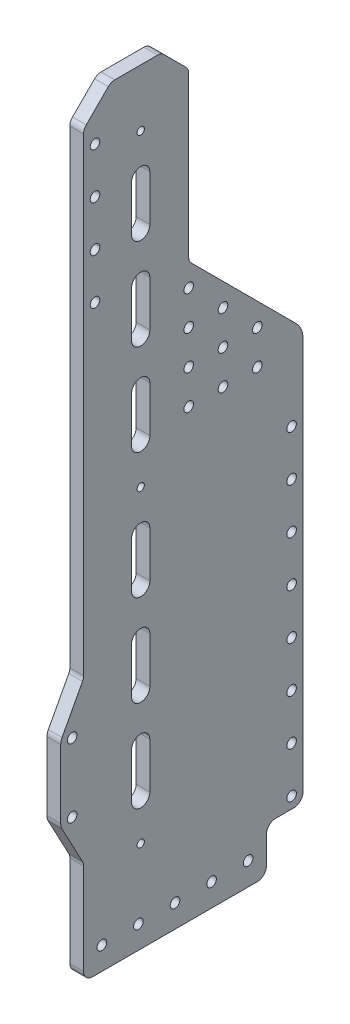
from build123d import *

# Parameters (mm, degrees)
SKETCH_1_W          = 80
SKETCH_1_H          = 315
SKETCH_1_R          = 1.6
SKETCH_1_H_2        = 20
SKETCH_1_R_2        = 2.1
EXTRUDE_1_DEPTH     = 6
SKETCH_2_W          = 16
SKETCH_2_H          = 180
EXTRUDE_2_DEPTH     = 6
SKETCH_3_W          = 34
SKETCH_3_H          = 85
CUT_EXTRUDE_1_DEPTH = 337.756588651
CHAMFER_1_SIZE      = 16
CHAMFER_2_SIZE      = 34
SKETCH_5_R          = 2.1
CUT_EXTRUDE_2_DEPTH = 337.756588651
SKETCH_5_3_R        = 2.1
EXTRUDE_3_DEPTH     = 6
SKETCH_6_R          = 2.1
CUT_EXTRUDE_3_DEPTH = 337.756588651
FILLET_START        = -1
FILLET_1_DEPTH      = 8
CHAMFER_3_SIZE      = 12
FILLET_2_DEPTH      = 8
FILLET_2_2_DEPTH    = 6
SKETCH_7_R          = 2.1
CUT_EXTRUDE_4_DEPTH = 337.756588651
CUT_EXTRUDE_5_DEPTH = 337.756588651


with BuildPart() as part:
    # 草图1 → 凸台-拉伸1 (new body)
    # profile 1 of 2: a face of its own
    with BuildSketch(Plane(origin=(0, 0, 0), x_dir=(0, 0, -1), z_dir=(1, 0, 0))):
        with Locations((32, 167.5)):
            Rectangle(SKETCH_1_W, SKETCH_1_H)
        with Locations((17, 300)):
            Circle(SKETCH_1_R, mode=Mode.SUBTRACT)
        with Locations((17, 165)):
            Circle(SKETCH_1_R, mode=Mode.SUBTRACT)
        with Locations((17, 30)):
            Circle(SKETCH_1_R, mode=Mode.SUBTRACT)
    # profile 2 of 2: a face of its own
    with BuildSketch(Plane(origin=(0, 0, 0), x_dir=(0, 0, -1), z_dir=(1, 0, 0))):
        with Locations((32, 0)):
            Rectangle(SKETCH_1_W, SKETCH_1_H_2)
        with Locations((64, 0)):
            Circle(SKETCH_1_R_2, mode=Mode.SUBTRACT)
        with Locations((48, 0)):
            Circle(SKETCH_1_R_2, mode=Mode.SUBTRACT)
        with Locations((32, 0)):
            Circle(SKETCH_1_R_2, mode=Mode.SUBTRACT)
        with Locations((16, 0)):
            Circle(SKETCH_1_R_2, mode=Mode.SUBTRACT)
        Circle(SKETCH_1_R_2, mode=Mode.SUBTRACT)
    extrude(amount=EXTRUDE_1_DEPTH)

    # 草图2 → 凸台-拉伸2 (add)
    with BuildSketch(Plane.ZY):
        with Locations((-80, 100)):
            Rectangle(SKETCH_2_W, SKETCH_2_H)
    extrude(amount=-EXTRUDE_2_DEPTH)

    # 草图3 → 切除-拉伸1 (cut, through all)
    with BuildSketch(Plane.ZY):
        with Locations((-55, 282.5)):
            Rectangle(SKETCH_3_W, SKETCH_3_H)
    extrude(amount=-CUT_EXTRUDE_1_DEPTH, mode=Mode.SUBTRACT)

    # 倒角1
    chamfer_1_edges = [part.edges().sort_by_distance(p)[0] for p in [
        (3, 190, -72),
    ]]
    chamfer(chamfer_1_edges, length=CHAMFER_1_SIZE - 0.0001)  # a hair under: the kernel refuses the full size

    # 倒角2
    chamfer_2_edges = [part.edges().sort_by_distance(p)[0] for p in [
        (3, 240, -72),
    ]]
    chamfer(chamfer_2_edges, length=CHAMFER_2_SIZE - 0.0001)  # a hair under: the kernel refuses the full size

    # 草图5 → 切除-拉伸2 (cut, through all)
    with BuildSketch(Plane.ZY):
        with Locations((-83, 15)):
            Circle(SKETCH_5_R)
        with Locations((-83, 35)):
            Circle(SKETCH_5_R)
        with Locations((-83, 55)):
            Circle(SKETCH_5_R)
        with Locations((-83, 75)):
            Circle(SKETCH_5_R)
        with Locations((-83, 95)):
            Circle(SKETCH_5_R)
        with Locations((-83, 115)):
            Circle(SKETCH_5_R)
        with Locations((-83, 135)):
            Circle(SKETCH_5_R)
        with Locations((-83, 155)):
            Circle(SKETCH_5_R)
    extrude(amount=-CUT_EXTRUDE_2_DEPTH, mode=Mode.SUBTRACT)

    # 草图5<3> → 凸台-拉伸3 (add)
    with BuildSketch(Plane.ZY):
        with BuildLine():
            ThreePointArc((17.411764706, 52.647058824), (17.850712501, 53.787321875), (18, 55))
            Line((18, 55), (18, 85))
            ThreePointArc((18, 85), (17.850712501, 86.212678125), (17.411764706, 87.352941176))
            Line((17.411764706, 87.352941176), (8, 105))
            Line((8, 105), (8, 35))
            Line((8, 35), (17.411764706, 52.647058824))
        make_face()
        with Locations((13, 85)):
            Circle(SKETCH_5_3_R, mode=Mode.SUBTRACT)
        with Locations((13, 55)):
            Circle(SKETCH_5_3_R, mode=Mode.SUBTRACT)
    extrude(amount=-EXTRUDE_3_DEPTH)

    # 草图6 → 切除-拉伸3 (cut, through all)
    with BuildSketch(Plane.ZY):
        with Locations((-68, 185)):
            Circle(SKETCH_6_R)
        with Locations((-53, 185)):
            Circle(SKETCH_6_R)
        with Locations((-38, 185)):
            Circle(SKETCH_6_R)
        with Locations((-68, 200)):
            Circle(SKETCH_6_R)
        with Locations((-53, 200)):
            Circle(SKETCH_6_R)
        with Locations((-38, 200)):
            Circle(SKETCH_6_R)
        with Locations((-68, 215)):
            Circle(SKETCH_6_R)
        with Locations((-53, 215)):
            Circle(SKETCH_6_R)
        with Locations((-38, 215)):
            Circle(SKETCH_6_R)
        with Locations((-68, 230)):
            Circle(SKETCH_6_R)
        with Locations((-53, 230)):
            Circle(SKETCH_6_R)
        with Locations((-38, 230)):
            Circle(SKETCH_6_R)
        with Locations((-83, 200)):
            Circle(SKETCH_6_R)
        with Locations((-83, 215)):
            Circle(SKETCH_6_R)
        with Locations((-83, 230)):
            Circle(SKETCH_6_R)
    extrude(amount=-CUT_EXTRUDE_3_DEPTH, mode=Mode.SUBTRACT)

    # 圆角1: read off the stored shape, not the designer's step
    # 圆角1 outline → 圆角1 (cut)
    with BuildSketch(Plane.YZ.offset(FILLET_START)):
        with BuildLine():
            ThreePointArc((192.928932188, -85.071067812), (189.6846987, -87.238795325), (185.857864376, -88))
            Line((185.857864376, -88), (190, -88))
            Line((190, -88), (192.928932188, -85.071067812))
        make_face()
    extrude(amount=FILLET_1_DEPTH, mode=Mode.SUBTRACT)

    # 倒角3
    chamfer_3_edges = [part.edges().sort_by_distance(p)[0] for p in [
        (3, 325, 8),
        (3, 325, -38),
    ]]
    chamfer(chamfer_3_edges, length=CHAMFER_3_SIZE)

    # 圆角2: read off the stored shape, not the designer's step
    # 圆角2 outline → 圆角2 (cut)
    with BuildSketch(Plane.YZ.offset(FILLET_START)):
        with BuildLine():
            Line((313, -38), (314.171572875, -36.828427125))
            ThreePointArc((314.171572875, -36.828427125), (312.87387948, -37.69551813), (311.343145751, -38))
            Line((311.343145751, -38), (313, -38))
        make_face()
        with BuildLine():
            ThreePointArc((311.343145751, 8), (312.87387948, 7.69551813), (314.171572875, 6.828427125))
            Line((314.171572875, 6.828427125), (313, 8))
            Line((313, 8), (311.343145751, 8))
        make_face()
        with BuildLine():
            ThreePointArc((323.828427125, -2.828427125), (324.69551813, -4.12612052), (325, -5.656854249))
            Line((325, -5.656854249), (325, -4))
            Line((325, -4), (323.828427125, -2.828427125))
        make_face()
        with BuildLine():
            ThreePointArc((325, -24.343145751), (324.69551813, -25.87387948), (323.828427125, -27.171572875))
            Line((323.828427125, -27.171572875), (325, -26))
            Line((325, -26), (325, -24.343145751))
        make_face()
        with BuildLine():
            Line((10, -88), (14, -88))
            ThreePointArc((14, -88), (11.171572875, -86.828427125), (10, -84))
            Line((10, -84), (10, -88))
        make_face()
        with BuildLine():
            Line((-10, 8), (-10, 4))
            ThreePointArc((-10, 4), (-8.828427125, 6.828427125), (-6, 8))
            Line((-6, 8), (-10, 8))
        make_face()
        with BuildLine():
            Line((-10, -72), (-6, -72))
            ThreePointArc((-6, -72), (-8.828427125, -70.828427125), (-10, -68))
            Line((-10, -68), (-10, -72))
        make_face()
    extrude(amount=FILLET_2_DEPTH, mode=Mode.SUBTRACT)

    # Fillet 2 2 outline → Fillet 2 2 (add)
    with BuildSketch(Plane.YZ):
        with BuildLine():
            ThreePointArc((238.828427125, -39.171572875), (240.12612052, -38.30448187), (241.656854249, -38))
            Line((241.656854249, -38), (240, -38))
            Line((240, -38), (238.828427125, -39.171572875))
        make_face()
        with BuildLine():
            Line((105, 8), (106, 8))
            ThreePointArc((106, 8), (105.0298575, 8.119429999), (104.117647059, 8.470588235))
            Line((104.117647059, 8.470588235), (105, 8))
        make_face()
        with BuildLine():
            ThreePointArc((35.882352941, 8.470588235), (34.9701425, 8.119429999), (34, 8))
            Line((34, 8), (35, 8))
            Line((35, 8), (35.882352941, 8.470588235))
        make_face()
        with BuildLine():
            ThreePointArc((6, -72), (8.828427125, -73.171572875), (10, -76))
            Line((10, -76), (10, -72))
            Line((10, -72), (6, -72))
        make_face()
    extrude(amount=FILLET_2_2_DEPTH)

    # 草图7 → 切除-拉伸4 (cut, through all)
    with BuildSketch(Plane.ZY):
        with Locations((3, 305)):
            Circle(SKETCH_7_R)
        with Locations((3, 285)):
            Circle(SKETCH_7_R)
        with Locations((3, 265)):
            Circle(SKETCH_7_R)
        with Locations((3, 245)):
            Circle(SKETCH_7_R)
    extrude(amount=-CUT_EXTRUDE_4_DEPTH, mode=Mode.SUBTRACT)

    # 草图8 → 切除-拉伸5 (cut, through all)
    with BuildSketch(Plane.ZY):
        with BuildLine():
            Line((-21, 222.5), (-21, 242.5))
            ThreePointArc((-21, 242.5), (-17, 246.5), (-13, 242.5))
            Line((-13, 242.5), (-13, 222.5))
            ThreePointArc((-13, 222.5), (-17, 218.5), (-21, 222.5))
        make_face()
        with BuildLine():
            Line((-21, 262.5), (-21, 282.5))
            ThreePointArc((-21, 282.5), (-17, 286.5), (-13, 282.5))
            Line((-13, 282.5), (-13, 262.5))
            ThreePointArc((-13, 262.5), (-17, 258.5), (-21, 262.5))
        make_face()
        with BuildLine():
            Line((-13, 182.5), (-13, 202.5))
            ThreePointArc((-13, 202.5), (-17, 206.5), (-21, 202.5))
            Line((-21, 202.5), (-21, 182.5))
            ThreePointArc((-21, 182.5), (-17, 178.5), (-13, 182.5))
        make_face()
        with BuildLine():
            Line((-21, 147.5), (-21, 127.5))
            ThreePointArc((-21, 127.5), (-17, 123.5), (-13, 127.5))
            Line((-13, 127.5), (-13, 147.5))
            ThreePointArc((-13, 147.5), (-17, 151.5), (-21, 147.5))
        make_face()
        with BuildLine():
            Line((-21, 107.5), (-21, 87.5))
            ThreePointArc((-21, 87.5), (-17, 83.5), (-13, 87.5))
            Line((-13, 87.5), (-13, 107.5))
            ThreePointArc((-13, 107.5), (-17, 111.5), (-21, 107.5))
        make_face()
        with BuildLine():
            Line((-21, 67.5), (-21, 47.5))
            ThreePointArc((-21, 47.5), (-17, 43.5), (-13, 47.5))
            Line((-13, 47.5), (-13, 67.5))
            ThreePointArc((-13, 67.5), (-17, 71.5), (-21, 67.5))
        make_face()
    extrude(amount=-CUT_EXTRUDE_5_DEPTH, mode=Mode.SUBTRACT)


solid = part.part
